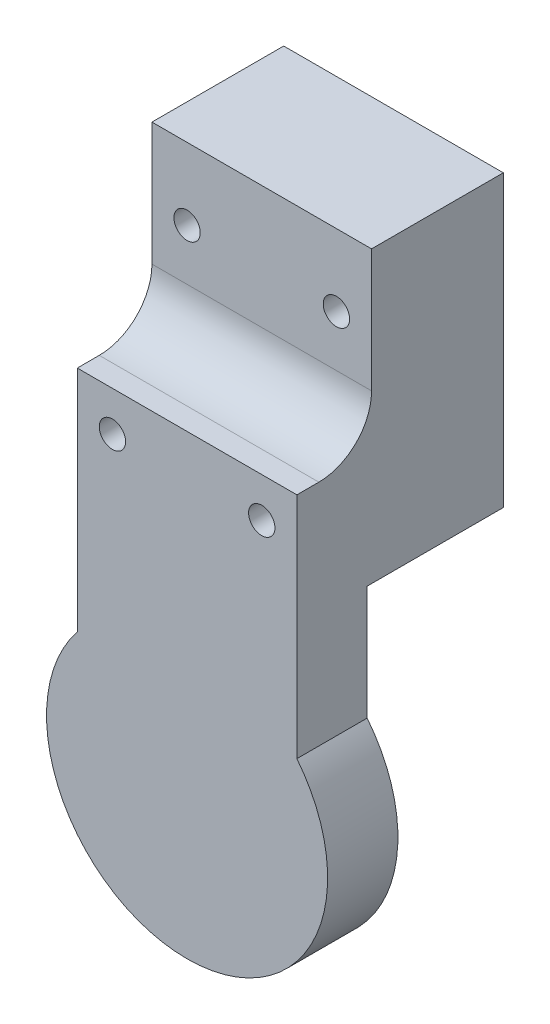
from build123d import *
from build123d.topology import SkipClean

# Parameters (mm, degrees)
BOSS_EXTRUDE1_DEPTH     = 1.4
BOSS_EXTRUDE2_DEPTH     = 0.7
SKETCH3_W               = 2
SKETCH3_H               = 1
SKETCH3_R               = 2.5
BOSS_EXTRUDE3_DEPTH     = 0.6
SKETCH4_R               = 2
SKETCH4_R_2             = 0.75
SKETCH4_W               = 2
SKETCH4_H               = 1
BOSS_EXTRUDE4_DEPTH     = 1.3
BOSS_EXTRUDE6_REACH     = 14
CHAMFER1_SIZE           = 2
SKETCH7_W               = 12.5
SKETCH7_H               = 6.503126956
BOSS_EXTRUDE7_DEPTH     = 7.75
SKETCH8_W               = 12.5
SKETCH8_H               = 7.5
BOSS_EXTRUDE8_DEPTH     = 10
FILLET1_R               = 3
SKETCH9_W               = 11
SKETCH9_H               = 1.9
BOSS_EXTRUDE9_DEPTH     = 3.003289
BOSS_EXTRUDE10_START    = -0.75
SKETCH10_R              = 0.75
SKETCH10_R_2            = 2
SKETCH10_W              = 2
SKETCH10_H              = 1
BOSS_EXTRUDE10_DEPTH    = 0.75
SKETCH11_R              = 2
BOSS_EXTRUDE11_DEPTH    = 2.5
FILLET2_SIZE            = 2.5
FILLET2_SIZE_2          = 1
CUT_EXTRUDE1_DEPTH      = 32.401632123
CUT_EXTRUDE1_DEPTH_BACK = 32.401632123
SKETCH12_R              = 0.75
CUT_EXTRUDE2_REACH      = 34.731
SKETCH13_W              = 2.1
SKETCH13_H              = 1


with BuildPart() as part:
    # Sketch1 → Boss-Extrude1 (new body)
    with BuildSketch(Plane.XY):
        with BuildLine():
            Line((-5.5, 5.809475019), (-5.5, -2.5))
            Line((-5.5, -2.5), (-2.5, -5.5))
            Line((-2.5, -5.5), (2.5, -5.5))
            Line((2.5, -5.5), (5.5, -2.5))
            Line((5.5, -2.5), (5.5, 5.809475019))
            ThreePointArc((5.5, 5.809475019), (0, -8), (-5.5, 5.809475019))
        make_face()
    extrude(amount=BOSS_EXTRUDE1_DEPTH)

    # Sketch2 → Boss-Extrude2 (add)
    with BuildSketch(Plane.XY.offset(1.4)):
        with BuildLine():
            Line((-1, -5.5), (-1, -6.5))
            Line((-1, -6.5), (1, -6.5))
            Line((1, -6.5), (1, -5.5))
            Line((1, -5.5), (2.5, -5.5))
            Line((2.5, -5.5), (5.5, -2.5))
            Line((5.5, -2.5), (5.5, 5.809475019))
            ThreePointArc((5.5, 5.809475019), (0, -8), (-5.5, 5.809475019))
            Line((-5.5, 5.809475019), (-5.5, -2.5))
            Line((-5.5, -2.5), (-2.5, -5.5))
            Line((-2.5, -5.5), (-1, -5.5))
        make_face()
    extrude(amount=BOSS_EXTRUDE2_DEPTH)

    # Sketch3 → Boss-Extrude3 (add)
    with BuildSketch(Plane.XY.offset(2.1)):
        with BuildLine():
            Line((-5.5, 6.5), (-5.5, 5.809475019))
            ThreePointArc((-5.5, 5.809475019), (0, -8), (5.5, 5.809475019))
            Line((5.5, 5.809475019), (5.5, 6.5))
            Line((5.5, 6.5), (-5.5, 6.5))
        make_face()
        with Locations((0, -6)):
            Rectangle(SKETCH3_W, SKETCH3_H, mode=Mode.SUBTRACT)
        Circle(SKETCH3_R, mode=Mode.SUBTRACT)
        with BuildLine():
            ThreePointArc((-3.499999999, 5.5), (-4.249999999, 4.75), (-4.999999999, 5.5))
            ThreePointArc((-4.999999999, 5.5), (-4.249999999, 6.25), (-3.499999999, 5.5))
        make_face(mode=Mode.SUBTRACT)
        with BuildLine():
            ThreePointArc((5.000000001, 5.5), (4.250000001, 4.75), (3.500000001, 5.5))
            ThreePointArc((3.500000001, 5.5), (4.250000001, 6.25), (5.000000001, 5.5))
        make_face(mode=Mode.SUBTRACT)
    extrude(amount=BOSS_EXTRUDE3_DEPTH)

    # Sketch4 → Boss-Extrude4 (add)
    with SkipClean():  # the faces are left unmerged after this step: merging them gives an invalid solid
        with BuildSketch(Plane.XY.offset(2.7)):
            with BuildLine():
                Line((-5.5, 5.809475019), (-5.5, 6.5))
                Line((-5.5, 6.5), (5.5, 6.5))
                Line((5.5, 6.5), (5.5, 5.809475019))
                ThreePointArc((5.5, 5.809475019), (0, -8), (-5.5, 5.809475019))
            make_face()
            Circle(SKETCH4_R, mode=Mode.SUBTRACT)
            with Locations((-4.249999999, 5.5)):
                Circle(SKETCH4_R_2, mode=Mode.SUBTRACT)
            with Locations((4.250000001, 5.5)):
                Circle(SKETCH4_R_2, mode=Mode.SUBTRACT)
            with Locations((0, -6)):
                Rectangle(SKETCH4_W, SKETCH4_H, mode=Mode.SUBTRACT)
        extrude(amount=BOSS_EXTRUDE4_DEPTH)

    # Boss-Extrude6: up to this face of the body (flat: up to its plane)
    boss_extrude6_end = Plane(part.part.faces().sort_by_distance((0, -7.784071771, 4))[0])
    # Sketch5 → Boss-Extrude6 (add, up to the picked face)
    with BuildSketch(Plane.XY, mode=Mode.PRIVATE) as boss_extrude6_sk1:
        with BuildLine():
            Line((-6.25, 4.993746089), (-6.25, 18))
            Line((-6.25, 18), (6.25, 18))
            Line((6.25, 18), (6.25, 4.993746089))
            ThreePointArc((6.25, 4.993746089), (5.88914072, 5.414611858), (5.5, 5.809475019))
            Line((5.5, 5.809475019), (5.5, 6.5))
            Line((5.5, 6.5), (4.249999999, 8.5))
            ThreePointArc((4.249999999, 8.5), (0, 9.503288904), (-4.249999999, 8.5))
            Line((-4.249999999, 8.5), (-5.5, 6.5))
            Line((-5.5, 6.5), (-5.5, 5.809475019))
            ThreePointArc((-5.5, 5.809475019), (-5.88914072, 5.414611858), (-6.25, 4.993746089))
        make_face()
    boss_extrude6_tool1 = split(extrude(boss_extrude6_sk1.sketch, amount=BOSS_EXTRUDE6_REACH, mode=Mode.PRIVATE), bisect_by=boss_extrude6_end, keep=Keep.BOTH, mode=Mode.PRIVATE)
    add(boss_extrude6_tool1.solids().sort_by(Axis((0, 13.103061, 0), (0, 0, 1)))[0])

    # Chamfer1
    chamfer1_edges = [part.edges().sort_by_distance(p)[0] for p in [
        (0, 9.503288904, 0),
    ]]
    chamfer(chamfer1_edges, length=CHAMFER1_SIZE)

    # Sketch7 → Boss-Extrude7 (add)
    with BuildSketch(Plane(origin=(0, 0, 0), x_dir=(-1, 0, 0), z_dir=(0, 0, -1))):
        with Locations((0, 14.748436522)):
            Rectangle(SKETCH7_W, SKETCH7_H)
    extrude(amount=BOSS_EXTRUDE7_DEPTH)

    # Sketch8 → Boss-Extrude8 (add)
    with SkipClean():  # the faces are left unmerged after this step: merging them gives an invalid solid
        with BuildSketch(Plane(origin=(0, 18, 0), x_dir=(1, 0, 0), z_dir=(0, 1, 0))):
            with Locations((0, 4)):
                Rectangle(SKETCH8_W, SKETCH8_H)
        extrude(amount=BOSS_EXTRUDE8_DEPTH)

    # Fillet1
    # the kernel refuses this fillet: 3 mm, written as the material it adds along each edge
    with BuildSketch(Plane(origin=(-6.25, 18, -0.25), x_dir=(0, 0, 1), z_dir=(1, 0, 0))) as fillet1_piece_1:
        with BuildLine():
            CenterArc((FILLET1_R, -FILLET1_R), FILLET1_R, 90, 90)
            Line((0, -FILLET1_R), (0, 0))
            Line((0, 0), (FILLET1_R, 0))
        make_face()
    extrude(amount=12.5)

    # Sketch9 → Boss-Extrude9 (add)
    with BuildSketch(Plane(origin=(0, 6.5, 0), x_dir=(1, 0, 0), z_dir=(0, 1, 0))):
        with Locations((0, -3.05)):
            Rectangle(SKETCH9_W, SKETCH9_H)
    extrude(amount=BOSS_EXTRUDE9_DEPTH)

    # Sketch10 → Boss-Extrude10 (add)
    with SkipClean():  # the faces are left unmerged after this step: merging them gives an invalid solid
        with BuildSketch(Plane.XY.offset(4).offset(BOSS_EXTRUDE10_START)):
            with Locations((4.250000001, 5.5)):
                Circle(SKETCH10_R)
            with Locations((-4.249999999, 5.5)):
                Circle(SKETCH10_R)
            Circle(SKETCH10_R_2)
            with Locations((0, -6)):
                Rectangle(SKETCH10_W, SKETCH10_H)
        extrude(amount=BOSS_EXTRUDE10_DEPTH)
    add(part.part.scale(1), mode=Mode.REPLACE)  # the faces are merged on a copy

    # Sketch11 → Boss-Extrude11 (add)
    with BuildSketch(Plane(origin=(0, 0, -7.75), x_dir=(-1, 0, 0), z_dir=(0, 0, -1))):
        with Locations(Location((0, 15.622654783, 0), (0, 0, 180))):
            Circle(SKETCH11_R)
        with Locations(Location((0, 23.874218261, 0), (0, 0, 180))):
            Circle(SKETCH11_R)
    extrude(amount=BOSS_EXTRUDE11_DEPTH)

    # Fillet2
    # an asymmetric fillet: 2.5, 1 mm, written as the material it takes off along each edge
    with BuildSketch(Plane(origin=(0, 15.622654783, -10.25), x_dir=(1, 0, 0), z_dir=(0, 1, 0))) as fillet2_piece_1:
        with BuildLine():
            Bezier((2, -FILLET2_SIZE), (2, 0), (2 - FILLET2_SIZE_2, 0), weights=[1, 0.707106781, 1])
            Line((2 - FILLET2_SIZE_2, 0), (2, 0))
            Line((2, 0), (2, -FILLET2_SIZE))
        make_face()
    revolve(axis=Axis((0, 15.622654783, -10.25), (0, 0, -1)), mode=Mode.SUBTRACT)
    with BuildSketch(Plane(origin=(0, 23.874218261, -10.25), x_dir=(1, 0, 0), z_dir=(0, 1, 0))) as fillet2_piece_2:
        with BuildLine():
            Bezier((2, -FILLET2_SIZE), (2, 0), (2 - FILLET2_SIZE_2, 0), weights=[1, 0.707106781, 1])
            Line((2 - FILLET2_SIZE_2, 0), (2, 0))
            Line((2, 0), (2, -FILLET2_SIZE))
        make_face()
    revolve(axis=Axis((0, 23.874218261, -10.25), (0, 0, -1)), mode=Mode.SUBTRACT)

    # Sketch12 → Cut-Extrude1 (cut, two sides: drawn at the far end of the back side and taken through both)
    with BuildSketch(Plane(origin=(0, 0, -7.75), x_dir=(-1, 0, 0), z_dir=(0, 0, -1)).offset(-CUT_EXTRUDE1_DEPTH_BACK)):
        with Locations((-4.25, 15.7375)):
            Circle(SKETCH12_R)
        with Locations((-4.25, 23.9125)):
            Circle(SKETCH12_R)
        with Locations((4.25, 23.9125)):
            Circle(SKETCH12_R)
        with Locations((4.25, 15.7375)):
            Circle(SKETCH12_R)
    extrude(amount=CUT_EXTRUDE1_DEPTH + CUT_EXTRUDE1_DEPTH_BACK, mode=Mode.SUBTRACT)

    # Cut-Extrude2: up to this face of the body (flat: up to its plane)
    cut_extrude2_end = Plane(part.part.faces().sort_by_distance((-5.5, 2, 1.05))[0])
    # Sketch13 → Cut-Extrude2 (cut, up to the picked face)
    with BuildSketch(Plane.ZY.offset(-5.5), mode=Mode.PRIVATE) as cut_extrude2_sk1:
        with Locations((1.05, 7)):
            Rectangle(SKETCH13_W, SKETCH13_H)
    cut_extrude2_tool1 = split(extrude(cut_extrude2_sk1.sketch, amount=CUT_EXTRUDE2_REACH, mode=Mode.PRIVATE), bisect_by=cut_extrude2_end, keep=Keep.BOTH, mode=Mode.PRIVATE)
    add(cut_extrude2_tool1.solids().sort_by(Axis((5.5, 7, 1.05), (-1, 0, 0)))[0], mode=Mode.SUBTRACT)


solid = part.part
